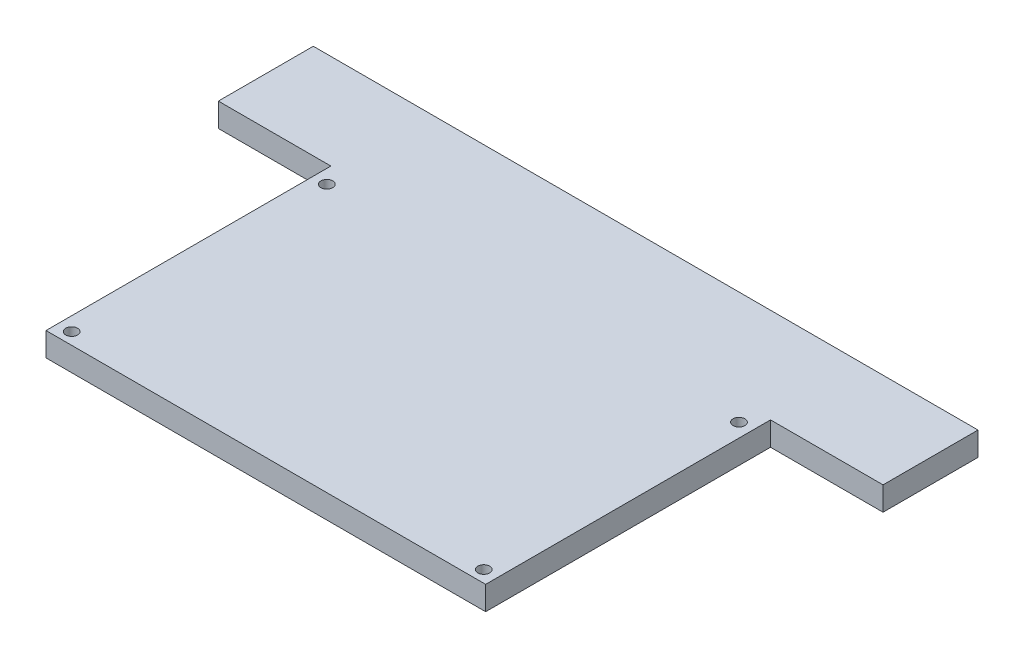
from build123d import *

# Parameters (mm, degrees)
SKETCH1_R           = 1.5875
BOSS_EXTRUDE2_DEPTH = 6.35


with BuildPart() as part:
    # Sketch1 → Boss-Extrude2 (new body)
    with BuildSketch(Plane(origin=(0, 0, 0), x_dir=(1, 0, 0), z_dir=(0, 1, 0))):
        Polygon((-58.801, 38.1), (-58.801, -38.1), (58.801, -38.1), (58.801, 38.1), (88.9, 38.1), (88.9, 63.5), (-88.9, 63.5), (-88.9, 38.1), align=None)
        with Locations((-55.118, -34.925)):
            Circle(SKETCH1_R, mode=Mode.SUBTRACT)
        with Locations((55.118, -34.925)):
            Circle(SKETCH1_R, mode=Mode.SUBTRACT)
        with Locations((-55.118, 33.3375)):
            Circle(SKETCH1_R, mode=Mode.SUBTRACT)
        with Locations((55.118, 33.3375)):
            Circle(SKETCH1_R, mode=Mode.SUBTRACT)
    extrude(amount=BOSS_EXTRUDE2_DEPTH)


solid = part.part
